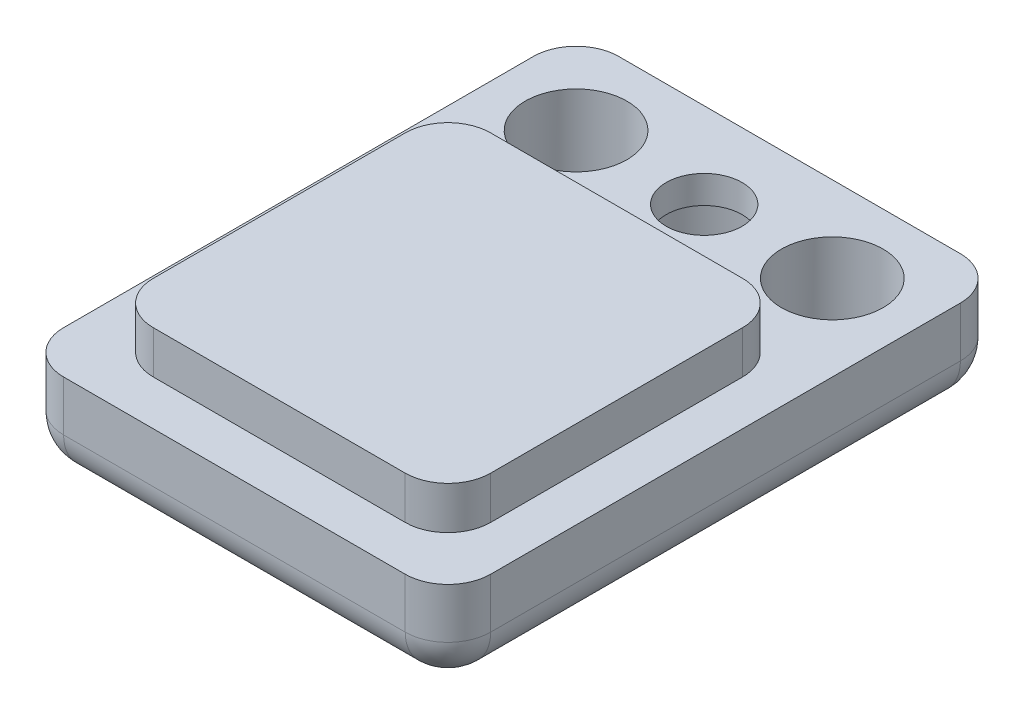
from build123d import *

# Parameters (mm, degrees)
SKETCH1_W                                      = 10
SKETCH1_H                                      = 13
EXTRUDE1_DEPTH                                 = 2.175
SKETCH3_W                                      = 7.9
SKETCH3_H                                      = 7.9
EXTRUDE3_DEPTH                                 = 1
CBORE_FOR_0_SOCKET_HEAD_CAP_SCREW1_D           = 1.778
CBORE_FOR_0_SOCKET_HEAD_CAP_SCREW1_CBORE_D     = 3.175
CBORE_FOR_0_SOCKET_HEAD_CAP_SCREW1_CBORE_DEPTH = 1.524
F_3_32_0_09375_DIAMETER_HOLE1_D                = 2.38125
F_3_32_0_09375_DIAMETER_HOLE1_DEPTH            = 10
F_3_32_0_09375_DIAMETER_HOLE1_TIP              = 0.715399675
FILLET3_R                                      = 1


with BuildPart() as part:
    # Sketch1 → Extrude1 (new body)
    with BuildSketch(Plane(origin=(0, 0, 0), x_dir=(1, 0, 0), z_dir=(0, 1, 0))):
        Rectangle(SKETCH1_W, SKETCH1_H)
    extrude(amount=EXTRUDE1_DEPTH)

    # Sketch3 → Extrude3 (add)
    with BuildSketch(Plane(origin=(0, 2.175, 0), x_dir=(1, 0, 0), z_dir=(0, 1, 0))):
        with Locations((0, -1.5)):
            Rectangle(SKETCH3_W, SKETCH3_H)
    extrude(amount=EXTRUDE3_DEPTH)

    # CBORE for #0 Socket Head Cap Screw1 (through all)
    with Locations(Plane(origin=(0, 0, -4.5), x_dir=(0, 0, -1), z_dir=(0, -1, 0))):
        with Locations((0, 0)):
            CounterBoreHole(CBORE_FOR_0_SOCKET_HEAD_CAP_SCREW1_D / 2, CBORE_FOR_0_SOCKET_HEAD_CAP_SCREW1_CBORE_D / 2, CBORE_FOR_0_SOCKET_HEAD_CAP_SCREW1_CBORE_DEPTH)

    # 3/32 (0.09375) Diameter Hole1
    with Locations(Plane(origin=(-3, 0, -4.5), x_dir=(0, 0, -1), z_dir=(0, -1, 0))):
        with Locations((0, 0), (0, 6)):
            Hole(F_3_32_0_09375_DIAMETER_HOLE1_D / 2, depth=F_3_32_0_09375_DIAMETER_HOLE1_DEPTH)
            with Locations((0, 0, -(F_3_32_0_09375_DIAMETER_HOLE1_DEPTH + F_3_32_0_09375_DIAMETER_HOLE1_TIP / 2))):  # 118° drill point
                Cone(0, F_3_32_0_09375_DIAMETER_HOLE1_D / 2, F_3_32_0_09375_DIAMETER_HOLE1_TIP, mode=Mode.SUBTRACT)

    # Fillet3
    # the kernel refuses this fillet: 1 mm, written as the material it takes off along each edge
    with BuildSketch(Plane(origin=(-4, 1, -5.5), x_dir=(0, -1, 0), z_dir=(-1, 0, 0))) as fillet3_piece_1_section:
        Polygon((0, 0), (FILLET3_R, 0), (FILLET3_R, -FILLET3_R), (0, -FILLET3_R), align=None)
    fillet3_piece_1 = extrude(amount=FILLET3_R, mode=Mode.PRIVATE)
    fillet3_piece_1 = fillet3_piece_1 - Plane(origin=(-4, 1, -5.5), x_dir=(0, 0.7071067811865475, 0.7071067811865475), z_dir=(-1, 0, 0)) * Sphere(FILLET3_R, mode=Mode.PRIVATE)
    add(fillet3_piece_1, mode=Mode.SUBTRACT)
    with BuildSketch(Plane(origin=(4, 1, -5.5), x_dir=(0, -1, 0), z_dir=(1, 0, 0))) as fillet3_piece_2_section:
        Polygon((0, 0), (FILLET3_R, 0), (FILLET3_R, FILLET3_R), (0, FILLET3_R), align=None)
    fillet3_piece_2 = extrude(amount=FILLET3_R, mode=Mode.PRIVATE)
    fillet3_piece_2 = fillet3_piece_2 - Plane(origin=(4, 1, -5.5), x_dir=(0, 0.7071067811865475, 0.7071067811865475), z_dir=(1, 0, 0)) * Sphere(FILLET3_R, mode=Mode.PRIVATE)
    add(fillet3_piece_2, mode=Mode.SUBTRACT)
    with BuildSketch(Plane(origin=(4, 1, 5.5), x_dir=(1, 0, 0), z_dir=(0, 0, 1))) as fillet3_piece_3_section:
        Polygon((0, 0), (FILLET3_R, 0), (FILLET3_R, -FILLET3_R), (0, -FILLET3_R), align=None)
    fillet3_piece_3 = extrude(amount=FILLET3_R, mode=Mode.PRIVATE)
    fillet3_piece_3 = fillet3_piece_3 - Plane(origin=(4, 1, 5.5), x_dir=(-0.7071067811865475, 0.7071067811865475, 0), z_dir=(0, 0, 1)) * Sphere(FILLET3_R, mode=Mode.PRIVATE)
    add(fillet3_piece_3, mode=Mode.SUBTRACT)
    with BuildSketch(Plane(origin=(-4, 1, 5.5), x_dir=(-1, 0, 0), z_dir=(0, 0, 1))) as fillet3_piece_4_section:
        Polygon((0, 0), (FILLET3_R, 0), (FILLET3_R, FILLET3_R), (0, FILLET3_R), align=None)
    fillet3_piece_4 = extrude(amount=FILLET3_R, mode=Mode.PRIVATE)
    fillet3_piece_4 = fillet3_piece_4 - Plane(origin=(-4, 1, 5.5), x_dir=(0.7071067811865475, 0.7071067811865475, 0), z_dir=(0, 0, 1)) * Sphere(FILLET3_R, mode=Mode.PRIVATE)
    add(fillet3_piece_4, mode=Mode.SUBTRACT)
    with BuildSketch(Plane(origin=(-3.95, 2.175, -2.45), x_dir=(0, 0, 1), z_dir=(0, 1, 0)), Plane(origin=(3.95, 2.175, -2.45), x_dir=(-1, 0, 0), z_dir=(0, 1, 0))) as fillet3_piece_5:
        with BuildLine():
            CenterArc((FILLET3_R, FILLET3_R), FILLET3_R, 180, 90)
            Line((0, FILLET3_R), (0, 0))
            Line((0, 0), (FILLET3_R, 0))
        make_face()
    extrude(amount=3.5, mode=Mode.SUBTRACT)
    with BuildSketch(Plane(origin=(-3.95, 2.175, 5.45), x_dir=(0, 0, -1), z_dir=(0, 1, 0)), Plane(origin=(3.95, 2.175, 5.45), x_dir=(-1, 0, 0), z_dir=(0, 1, 0))) as fillet3_piece_6:
        with BuildLine():
            CenterArc((FILLET3_R, -FILLET3_R), FILLET3_R, 90, 90)
            Line((0, -FILLET3_R), (0, 0))
            Line((0, 0), (FILLET3_R, 0))
        make_face()
    extrude(amount=3.5, mode=Mode.SUBTRACT)
    with BuildSketch(Plane(origin=(-4, 0, -6.5), x_dir=(0, 0, 1), z_dir=(1, 0, 0))) as fillet3_piece_7:
        with BuildLine():
            CenterArc((FILLET3_R, -FILLET3_R), FILLET3_R, 90, 90)
            Line((0, -FILLET3_R), (0, 0))
            Line((0, 0), (FILLET3_R, 0))
        make_face()
    extrude(amount=8, mode=Mode.SUBTRACT)
    with BuildSketch(Plane(origin=(5, 0, -5.5), x_dir=(0, 1, 0), z_dir=(0, 0, 1)), Plane(origin=(-5, 0, 5.5), x_dir=(0, 1, 0), z_dir=(0, 0, -1))) as fillet3_piece_8:
        with BuildLine():
            CenterArc((FILLET3_R, FILLET3_R), FILLET3_R, 180, 90)
            Line((0, FILLET3_R), (0, 0))
            Line((0, 0), (FILLET3_R, 0))
        make_face()
    extrude(amount=11, mode=Mode.SUBTRACT)
    with BuildSketch(Plane(origin=(4, 0, 6.5), x_dir=(0, 1, 0), z_dir=(-1, 0, 0))) as fillet3_piece_9:
        with BuildLine():
            CenterArc((FILLET3_R, FILLET3_R), FILLET3_R, 180, 90)
            Line((0, FILLET3_R), (0, 0))
            Line((0, 0), (FILLET3_R, 0))
        make_face()
    extrude(amount=8, mode=Mode.SUBTRACT)
    with BuildSketch(Plane(origin=(-5, 1, -6.5), x_dir=(0, 0, 1), z_dir=(0, 1, 0)), Plane(origin=(-5, 1, 6.5), x_dir=(1, 0, 0), z_dir=(0, 1, 0))) as fillet3_piece_10:
        with BuildLine():
            CenterArc((FILLET3_R, FILLET3_R), FILLET3_R, 180, 90)
            Line((0, FILLET3_R), (0, 0))
            Line((0, 0), (FILLET3_R, 0))
        make_face()
    extrude(amount=3.675, mode=Mode.SUBTRACT)
    with BuildSketch(Plane(origin=(5, 1, -6.5), x_dir=(0, 0, 1), z_dir=(0, 1, 0)), Plane(origin=(5, 1, 6.5), x_dir=(-1, 0, 0), z_dir=(0, 1, 0))) as fillet3_piece_11:
        with BuildLine():
            CenterArc((FILLET3_R, -FILLET3_R), FILLET3_R, 90, 90)
            Line((0, -FILLET3_R), (0, 0))
            Line((0, 0), (FILLET3_R, 0))
        make_face()
    extrude(amount=3.675, mode=Mode.SUBTRACT)


solid = part.part
